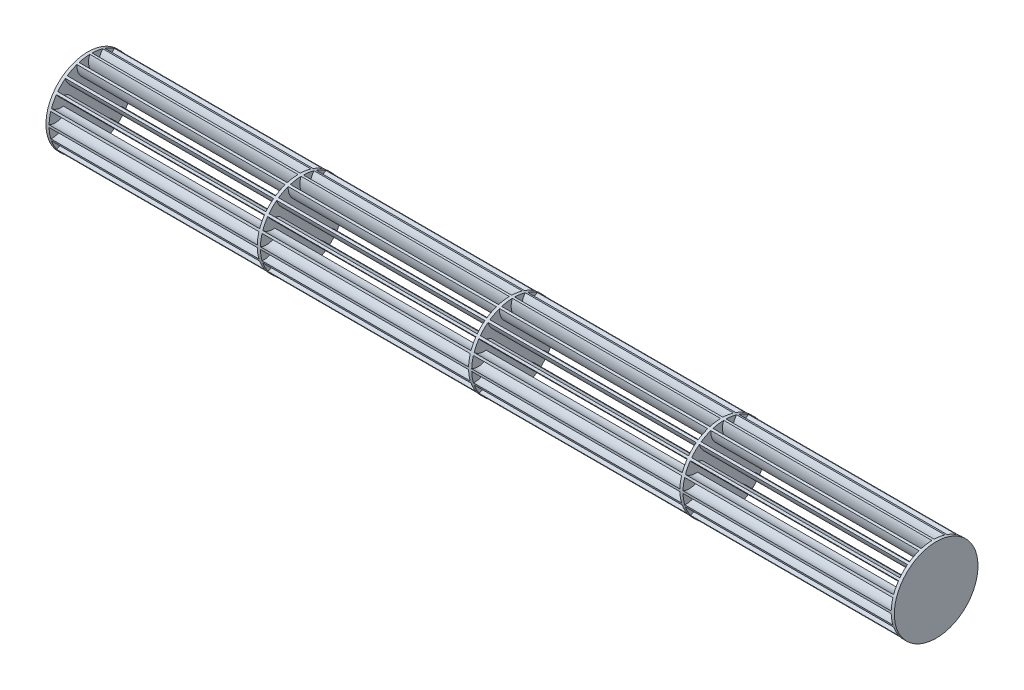
from build123d import *
from build123d.topology import SkipClean

# Parameters (mm, degrees)
SKETCH2_R           = 20
BOSS_EXTRUDE2_DEPTH = 1.5
BOSS_EXTRUDE1_DEPTH = 202
CIRPATTERN1_COUNT   = 20
LPATTERN1_COUNT     = 5
LPATTERN1_PITCH     = 101


with BuildPart() as part:
    # Sketch2 → Boss-Extrude2 (new body)
    with BuildSketch(Plane(origin=(202, 0, 0), x_dir=(0, 0, -1), z_dir=(1, 0, 0))):
        Circle(SKETCH2_R)
    boss_extrude2 = extrude(amount=-BOSS_EXTRUDE2_DEPTH)

    # Sketch1 → Boss-Extrude1 (add, symmetric)
    with BuildSketch(Plane(origin=(0, 0, 0), x_dir=(0, 0, -1), z_dir=(1, 0, 0))):
        with BuildLine():
            ThreePointArc((0.545877383, 19.992549059), (0, 20), (-0.545877383, 19.992549059))
            ThreePointArc((-0.545877383, 19.992549059), (-1.130325382, 16.990951396), (-0.545877383, 13.989353734))
            ThreePointArc((-0.545877383, 13.989353734), (0, 14), (0.545877383, 13.989353734))
            ThreePointArc((0.545877383, 13.989353734), (-0.130325382, 16.990951396), (0.545877383, 19.992549059))
        make_face()
    boss_extrude1 = extrude(amount=BOSS_EXTRUDE1_DEPTH, both=True)

    # CirPattern1: Boss-Extrude1 ×20 about axis
    cirpattern1_axis = Axis((202, 0, 0), (1, 0, 0))
    for i in range(1, CIRPATTERN1_COUNT):
        add(boss_extrude1.rotate(cirpattern1_axis, i * 360 / CIRPATTERN1_COUNT))

    # LPattern1: Boss-Extrude2 ×5
    with SkipClean():  # the faces are left unmerged after this step: merging them gives an invalid solid
        with Locations(*[(-i * LPATTERN1_PITCH, 0, 0) for i in range(1, LPATTERN1_COUNT)]):
            add(boss_extrude2)


solid = part.part
